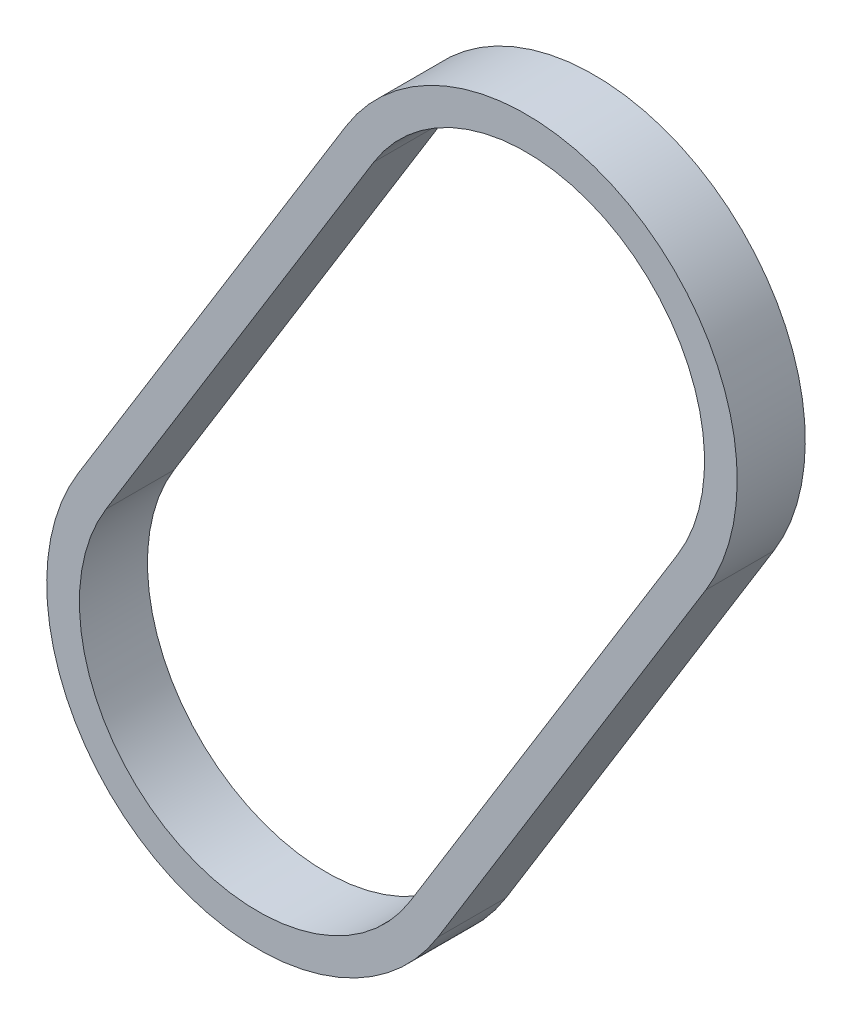
from build123d import *

# Parameters (mm, degrees)
EXTRUDE_THIN1_DEPTH = 5


with BuildPart() as part:
    # Sketch2 → Extrude-Thin1 (new body)
    with BuildSketch(Plane.XY):
        with BuildLine():
            Line((-13.215162023, 8.145695629), (6.461768581, 40.06854641))
            ThreePointArc((6.461768581, 40.06854641), (27.822626233, 45.138012804), (32.892092628, 23.777155152))
            Line((32.892092628, 23.777155152), (13.215162023, -8.145695629))
            ThreePointArc((13.215162023, -8.145695629), (-8.145695629, -13.215162023), (-13.215162023, 8.145695629))
        make_face()
        with BuildLine():
            Line((-11.172099573, 6.88637207), (8.504831031, 38.809222851))
            ThreePointArc((8.504831031, 38.809222851), (26.563302675, 43.094950354), (30.849030178, 25.036478711))
            Line((30.849030178, 25.036478711), (11.172099573, -6.88637207))
            ThreePointArc((11.172099573, -6.88637207), (-6.88637207, -11.172099573), (-11.172099573, 6.88637207))
        make_face(mode=Mode.SUBTRACT)
    extrude(amount=-EXTRUDE_THIN1_DEPTH)


solid = part.part
